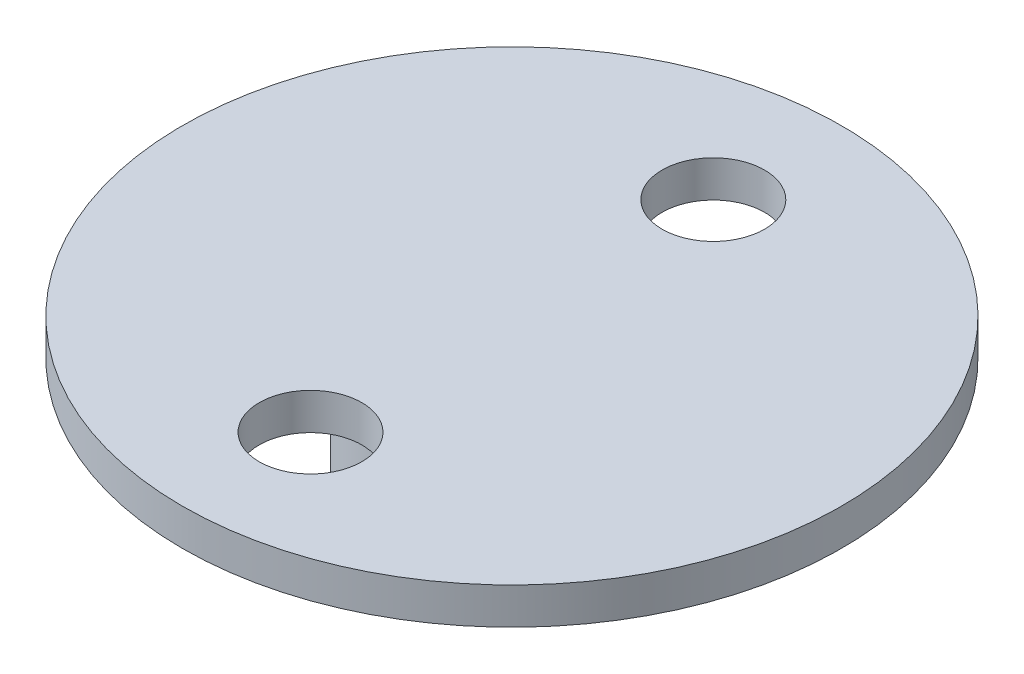
from build123d import *

# Parameters (mm, degrees)
SKETCH1_R           = 9
BOSS_EXTRUDE1_DEPTH = 1
SKETCH2_R           = 1.4
CUT_EXTRUDE1_DEPTH  = 13.767145335
SKETCH3_R           = 3.5
BOSS_EXTRUDE2_DEPTH = 3.5
FILLET1_R           = 0.5


with BuildPart() as part:
    # Sketch1 → Boss-Extrude1 (new body)
    with BuildSketch(Plane(origin=(0, 0, 0), x_dir=(1, 0, 0), z_dir=(0, 1, 0))):
        Circle(SKETCH1_R)
    extrude(amount=-BOSS_EXTRUDE1_DEPTH)

    # Sketch2 → Cut-Extrude1 (cut, through all)
    with BuildSketch(Plane(origin=(0, 0, 0), x_dir=(1, 0, 0), z_dir=(0, 1, 0))):
        with Locations((0, -5.5)):
            Circle(SKETCH2_R)
        with Locations((0, 5.5)):
            Circle(SKETCH2_R)
    extrude(amount=-CUT_EXTRUDE1_DEPTH, mode=Mode.SUBTRACT)

    # Sketch3 → Boss-Extrude2 (add)
    with BuildSketch(Plane.XZ.offset(1)):
        Circle(SKETCH3_R)
        with BuildLine():
            Line((1.985734783, 1.647196822), (2.166931392, -1.400288664))
            ThreePointArc((2.166931392, -1.400288664), (-2.575451618, -0.15313054), (1.985734783, 1.647196822))
        make_face(mode=Mode.SUBTRACT)
    extrude(amount=BOSS_EXTRUDE2_DEPTH)

    # Fillet1
    fillet1_edges = [part.edges().sort_by_distance(p)[0] for p in [
        (2.076333088, -4.5, 0.123454079),
        (-2.575451618, -4.5, -0.15313054),
    ]]
    fillet(fillet1_edges, radius=FILLET1_R)


solid = part.part
